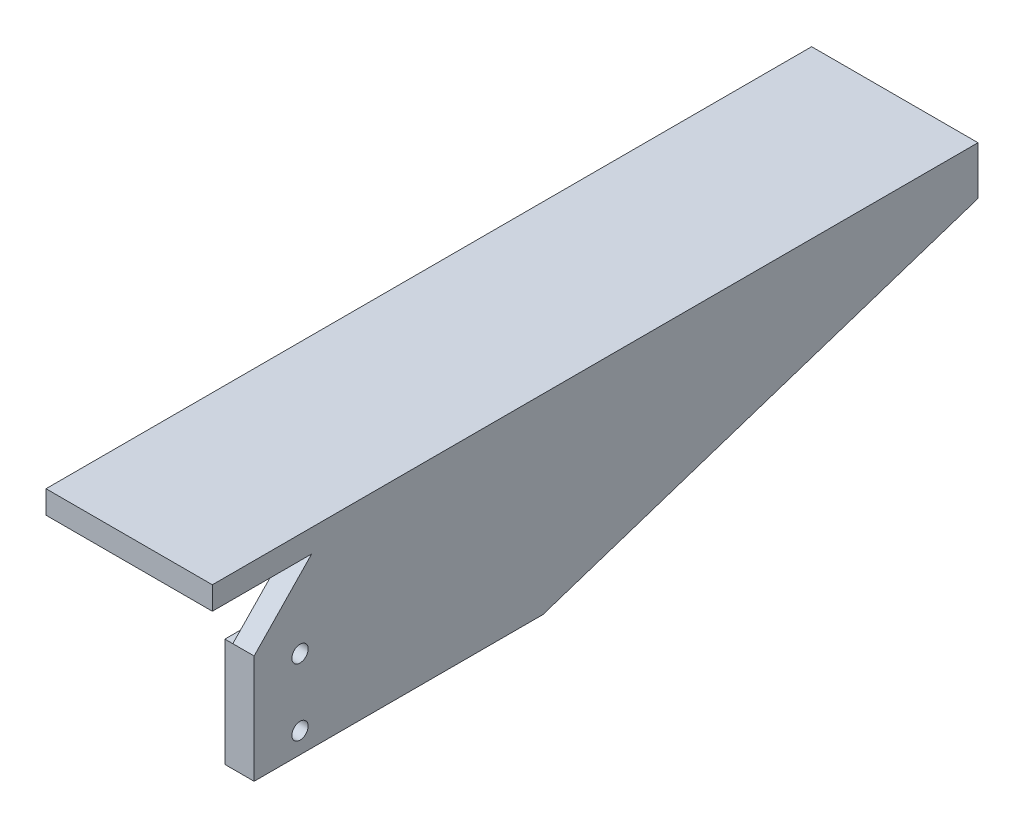
from build123d import *

# Parameters (mm, degrees)
LEG_AND_PAD_DEPTH                     = 13
SCREW_HEAD_RELIEF_SKETCH_W            = 14
SCREW_HEAD_RELIEF_SKETCH_H            = 6
SCREW_HEAD_RELIEF_DEPTH               = 2.35
M6_SLOT_MIDDLE_DEPTH                  = 3.5
SCREW_HOLES_SKETCH_R                  = 1.95
SCREW_HOLES_DEPTH                     = 4.5
FOOT_LEG_DEPTH                        = 6.1
SOLE_UNDER_THE_HOUSING_SKETCH_W       = 39.841788068
SOLE_UNDER_THE_HOUSING_SKETCH_H       = 155.03
SOLE_UNDER_THE_HOUSING_DEPTH          = 4.285
SOLE_UNDER_THE_BLOCK_SKETCH_W         = 39.841788068
SOLE_UNDER_THE_BLOCK_SKETCH_H         = 28.84
SOLE_UNDER_THE_BLOCK_DEPTH            = 2.75
SEAT_GUSSET_DEPTH                     = 2.55
TAIL_RIB_DEPTH                        = 3
SIDE_BRACE_DEPTH                      = 3.71
SCREW_HEAD_RELIEF_TO_THE_END_SKETCH_W = 14
SCREW_HEAD_RELIEF_TO_THE_END_SKETCH_H = 16
SCREW_HEAD_RELIEF_TO_THE_END_DEPTH    = 2.35


with BuildPart() as part:
    # leg and pad sketch → leg and pad (new, symmetric)
    with BuildSketch(Plane(origin=(0, -20.7, 0), x_dir=(1, 0, 0), z_dir=(0, 1, 0))):
        Polygon((-0.551289683, 30.332713936), (-0.367250577, 30.819395741), (-0.028023026, 31.213926146), (0.425575667, 31.468833575), (0.938966578, 31.553446481), (1.450376329, 31.457583879), (1.898269923, 31.192780366), (2.228754897, 30.790898227), (2.402065893, 30.30029363), (2.397349395, 29.779998208), (2.215172912, 29.292616119), (1.877456693, 28.896791249), (1.424836191, 28.640150931), (0.91177263, 28.55357522), (0.4, 28.647481273), (0.4, -9.98), (1.92, -11.5), (1.92, -31.37), (8.92, -31.37), (8.92, 32.792642706), (-27.204821487, 54.594667874), (-30.821788068, 48.601542416), align=None)
    extrude(amount=LEG_AND_PAD_DEPTH, both=True)

    # screw head relief sketch → screw head relief (cut, symmetric)
    with BuildSketch(Plane(origin=(1.35, 0, 0), x_dir=(0, 0, -1), z_dir=(1, 0, 0))):
        with Locations((16.4, -9.7)):
            Rectangle(SCREW_HEAD_RELIEF_SKETCH_W, SCREW_HEAD_RELIEF_SKETCH_H)
    extrude(amount=SCREW_HEAD_RELIEF_DEPTH, both=True, mode=Mode.SUBTRACT)

    # insert flange relief sketch → insert flange relief (revolve, cut)
    with BuildSketch(Plane(origin=(0, -20.7, 0), x_dir=(1, 0, 0), z_dir=(0, 1, 0))):
        Polygon((-18.324853729, 39.891397061), (-17.03307995, 42.03179901), (-9.755713323, 37.639768162), (-11.047487102, 35.499366213), align=None)
    revolve(axis=Axis((-18.324853729, -20.7, -39.891397061), (0.5167095115681243, 0, -0.8561607796757748)), mode=Mode.SUBTRACT)

    # M6 slot end 1 sketch → M6 slot end 1 (revolve, cut)
    with BuildSketch(Plane(origin=(0, -20.7, 0), x_dir=(1, 0, 0), z_dir=(0, 1, 0))):
        Polygon((-20.893336068, 41.441525596), (-16.242950464, 49.146972613), (-13.246387735, 47.338489322), (-17.896773339, 39.633042305), align=None)
    revolve(axis=Axis((-20.893336068, -20.7, -41.441525596), (0.5167095115681233, 0, -0.8561607796757753)), mode=Mode.SUBTRACT)

    # M6 slot end 2 sketch → M6 slot end 2 (revolve, cut)
    with BuildSketch(Plane(origin=(0, -20.7, 0), x_dir=(1, 0, 0), z_dir=(0, 1, 0))):
        Polygon((-15.75637139, 38.341268526), (-11.105985786, 46.046715543), (-8.109423057, 44.238232253), (-12.759808661, 36.532785236), align=None)
    revolve(axis=Axis((-15.75637139, -20.7, -38.341268526), (0.5167095115681234, 0, -0.8561607796757752)), mode=Mode.SUBTRACT)

    # M6 slot middle sketch → M6 slot middle (cut, symmetric)
    with BuildSketch(Plane(origin=(0, -20.7, 0), x_dir=(1, 0, 0), z_dir=(0, 1, 0))):
        Polygon((-15.75637139, 38.341268526), (-20.893336068, 41.441525596), (-16.242950464, 49.146972613), (-11.105985786, 46.046715543), align=None)
    extrude(amount=M6_SLOT_MIDDLE_DEPTH, both=True, mode=Mode.SUBTRACT)

    # screw holes sketch → screw holes (cut, symmetric)
    with BuildSketch(Plane(origin=(5.42, 0, 0), x_dir=(0, 0, -1), z_dir=(1, 0, 0))):
        with Locations((-20.375, -28.7)):
            Circle(SCREW_HOLES_SKETCH_R)
        with Locations((-20.375, -12.7)):
            Circle(SCREW_HOLES_SKETCH_R)
    extrude(amount=SCREW_HOLES_DEPTH, both=True, mode=Mode.SUBTRACT)

    # foot leg sketch → foot leg (add, symmetric)
    with BuildSketch(Plane(origin=(0, -2.1, 0), x_dir=(1, 0, 0), z_dir=(0, 1, 0))):
        Polygon((2.3, 30.013511625), (2.3, -9.98), (8.92, -9.98), (8.92, 32.792642706), (-27.204821487, 54.594667874), (-30.201736654, 49.628935352), align=None)
    extrude(amount=FOOT_LEG_DEPTH, both=True)

    # sole under the housing sketch → sole under the housing (add, symmetric)
    with BuildSketch(Plane(origin=(0, 7.785, 0), x_dir=(1, 0, 0), z_dir=(0, 1, 0))):
        with Locations((-11.000894034, 64.485)):
            Rectangle(SOLE_UNDER_THE_HOUSING_SKETCH_W, SOLE_UNDER_THE_HOUSING_SKETCH_H)
    extrude(amount=SOLE_UNDER_THE_HOUSING_DEPTH, both=True)

    # sole under the block sketch → sole under the block (add, symmetric)
    with BuildSketch(Plane(origin=(0, 9.32, 0), x_dir=(1, 0, 0), z_dir=(0, 1, 0))):
        with Locations((-11.000894034, -26.95)):
            Rectangle(SOLE_UNDER_THE_BLOCK_SKETCH_W, SOLE_UNDER_THE_BLOCK_SKETCH_H)
    extrude(amount=SOLE_UNDER_THE_BLOCK_DEPTH, both=True)

    # seat gusset sketch → seat gusset (add, symmetric)
    with BuildSketch(Plane(origin=(6.37, 0, 0), x_dir=(0, 0, -1), z_dir=(1, 0, 0))):
        Polygon((-9.48, -8.2), (-31.37, -8.2), (-31.37, -7.7), (-17.1, 7.07), (-9.48, 7.07), align=None)
    extrude(amount=SEAT_GUSSET_DEPTH, both=True)

    # tail rib sketch → tail rib (add, symmetric)
    with BuildSketch(Plane(origin=(-19.921788068, 0, 0), x_dir=(0, 0, -1), z_dir=(1, 0, 0))):
        Polygon((53.1, 4), (53.1, -12.5), (57.1, -12.5), (140, 3.5), (140, 4), align=None)
    extrude(amount=TAIL_RIB_DEPTH, both=True)

    # side brace sketch → side brace (add, symmetric)
    with BuildSketch(Plane(origin=(5.21, 0, 0), x_dir=(0, 0, -1), z_dir=(1, 0, 0))):
        Polygon((142, 4), (142, 0.5), (37.792642706, -33.7), (31.792642706, -33.7), (31.792642706, 4), align=None)
    extrude(amount=SIDE_BRACE_DEPTH, both=True)

    # screw head relief to the end sketch → screw head relief to the end (cut, symmetric)
    with BuildSketch(Plane(origin=(1.35, 0, 0), x_dir=(0, 0, -1), z_dir=(1, 0, 0))):
        with Locations((16.4, -4.7)):
            Rectangle(SCREW_HEAD_RELIEF_TO_THE_END_SKETCH_W, SCREW_HEAD_RELIEF_TO_THE_END_SKETCH_H)
    extrude(amount=SCREW_HEAD_RELIEF_TO_THE_END_DEPTH, both=True, mode=Mode.SUBTRACT)


solid = part.part
